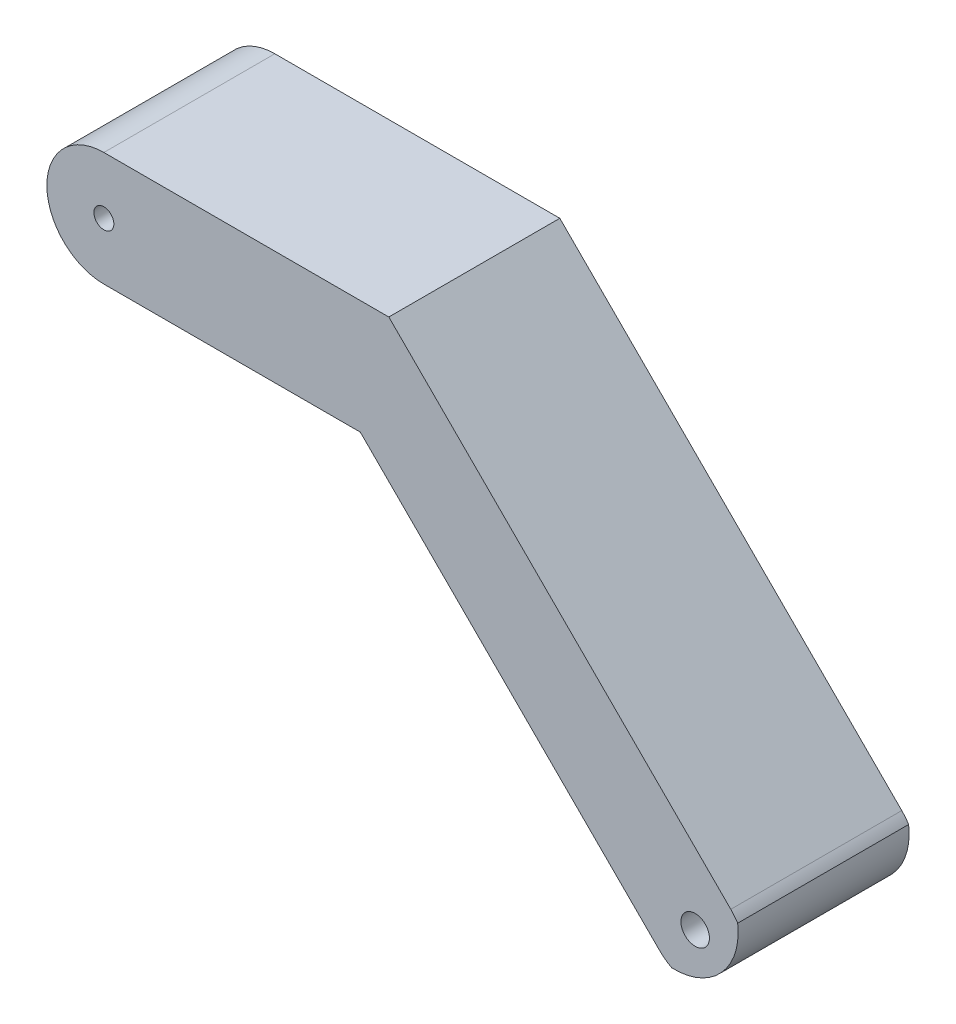
from build123d import *

# Parameters (mm, degrees)
SKETCH2_R           = 1.75
SKETCH2_R_2         = 2.5
BOSS_EXTRUDE1_DEPTH = 15
SPLIT1_START        = -15
SPLIT1_DEPTH        = 30


# Read off the part's stored shape, not the designer's step: Split1
with BuildPart() as part:
    # Sketch2 → Boss-Extrude1 (new, symmetric)
    with BuildSketch(Plane.XY):
        with BuildLine():
            Line((0, 10), (50, 10))
            Line((50, 10), (110, -50))
            ThreePointArc((110, -50), (109.927822148, -62.57300177), (97.356477729, -62.356477729))
            Line((97.356477729, -62.356477729), (45, -10))
            Line((45, -10), (0, -10))
            ThreePointArc((0, -10), (-10, 0), (0, 10))
        make_face()
        Circle(SKETCH2_R, mode=Mode.SUBTRACT)
        with Locations((103.749176054, -56.250823946)):
            Circle(SKETCH2_R_2, mode=Mode.SUBTRACT)
    extrude(amount=BOSS_EXTRUDE1_DEPTH, both=True)

    # Split1 outline → Split1 (cut)
    with BuildSketch(Plane.XY.offset(SPLIT1_START)):
        with BuildLine():
            ThreePointArc((111.20911577, -51.507945133), (108.320634217, -60.472229721), (99.61434242, -64.06419395))
            ThreePointArc((99.61434242, -64.06419395), (110.24370673, -62.248045911), (111.20911577, -51.507945133))
        make_face()
    extrude(amount=SPLIT1_DEPTH, mode=Mode.SUBTRACT)


solid = part.part
